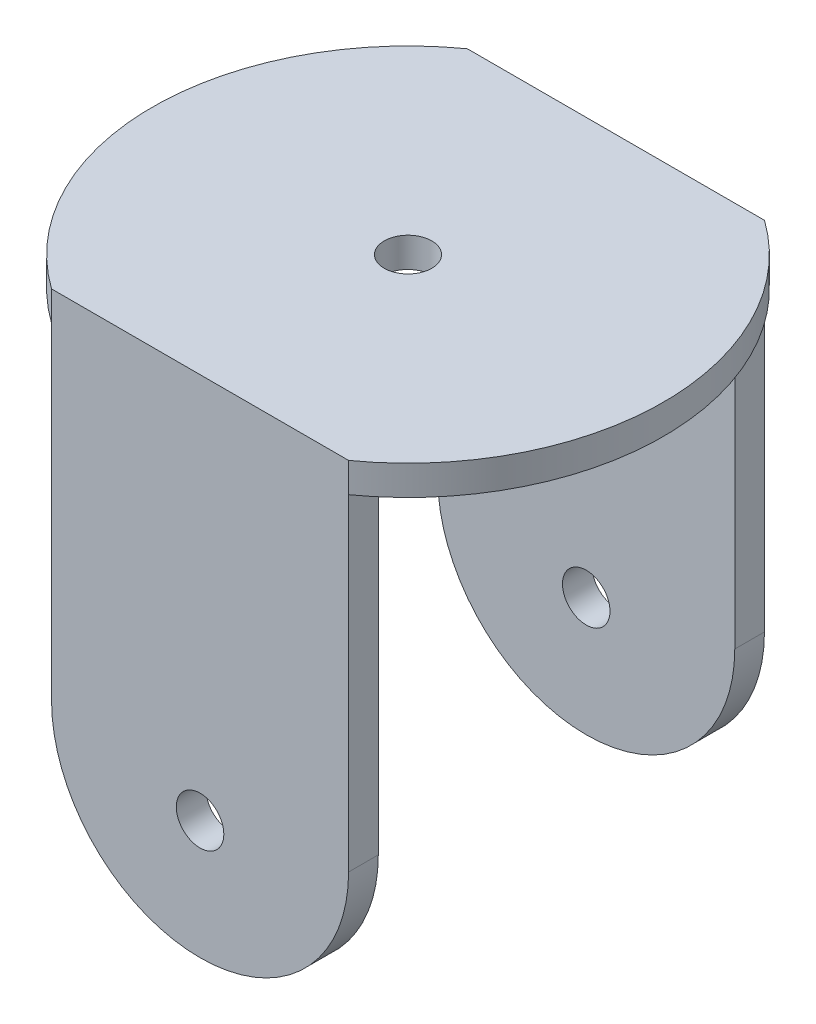
from build123d import *

# Parameters (mm, degrees)
SKETCH_1_W          = 50
SKETCH_1_H          = 80
EXTRUDE_1_DEPTH     = 5
SKETCH_2_W          = 50
SKETCH_2_H          = 80
EXTRUDE_2_DEPTH     = 5
EXTRUDE_3_DEPTH     = 5
SKETCH_4_R          = 4
CUT_EXTRUDE_1_DEPTH = 94.674969976
SKETCH_5_R          = 4
CUT_EXTRUDE_2_DEPTH = 119.215904175
FILLET_1_R          = 25


with BuildPart() as part:
    # 草图1 → 凸台-拉伸1 (new body)
    with BuildSketch(Plane.XY):
        Rectangle(SKETCH_1_W, SKETCH_1_H)
    extrude(amount=EXTRUDE_1_DEPTH)



with BuildPart() as body_2:
    # 草图2 → 凸台-拉伸2 (new body)
    with BuildSketch(Plane.XY.offset(65)):
        Rectangle(SKETCH_2_W, SKETCH_2_H)
    extrude(amount=EXTRUDE_2_DEPTH)


with BuildPart() as part_1:
    add(part.part)

    add(body_2.part)  # 凸台-拉伸3 merges body 2
    # 草图3 → 凸台-拉伸3 (add)
    with BuildSketch(Plane(origin=(0, 40, 0), x_dir=(1, 0, 0), z_dir=(0, 1, 0))):
        with BuildLine():
            Line((-25, 0), (25, 0))
            ThreePointArc((25, 0), (43.011626335, -35), (25, -70))
            Line((25, -70), (-25, -70))
            ThreePointArc((-25, -70), (-43.011626335, -35), (-25, 0))
        make_face()
    extrude(amount=EXTRUDE_3_DEPTH)

    # 草图4 → 切除-拉伸1 (cut, through all)
    with BuildSketch(Plane.XY.offset(70)):
        with Locations((0, -20)):
            Circle(SKETCH_4_R)
    extrude(amount=-CUT_EXTRUDE_1_DEPTH, mode=Mode.SUBTRACT)

    # 草图5 → 切除-拉伸2 (cut, through all)
    with BuildSketch(Plane(origin=(0, 45, 0), x_dir=(1, 0, 0), z_dir=(0, 1, 0))):
        with Locations(Location((0, -35, 0), (0, 0, 180))):
            Circle(SKETCH_5_R)
    extrude(amount=-CUT_EXTRUDE_2_DEPTH, mode=Mode.SUBTRACT)

    # 圆角1
    fillet_1_edges = [part_1.edges().sort_by_distance(p)[0] for p in [
        (-25, -40, 2.5),
        (25, -40, 2.5),
        (25, -40, 67.5),
        (-25, -40, 67.5),
    ]]
    fillet(fillet_1_edges, radius=FILLET_1_R - 0.0001)  # a hair under: the kernel refuses the full size


solid = part_1.part
